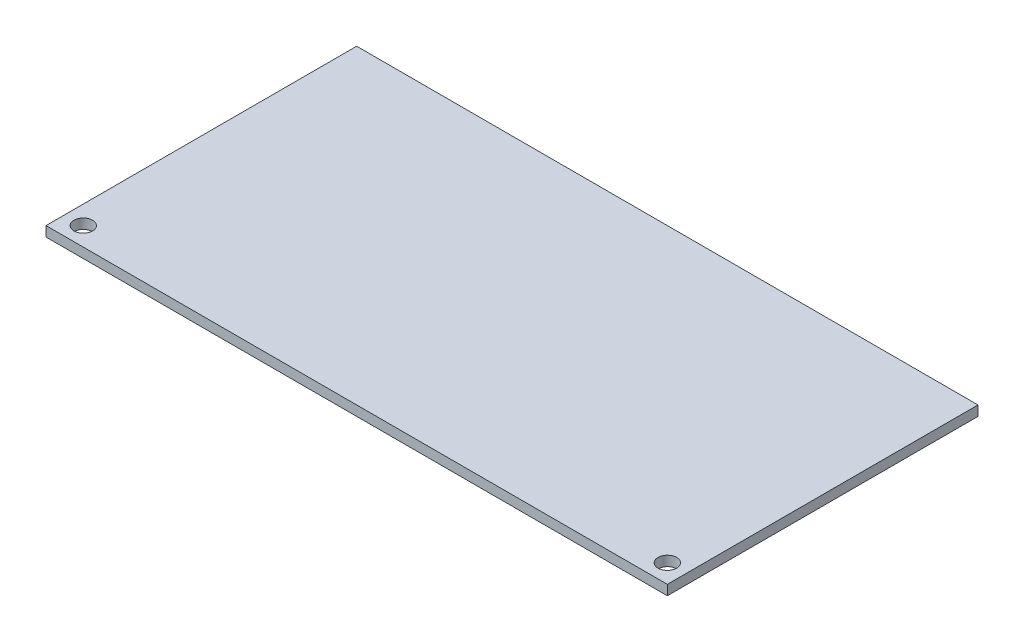
from build123d import *

# Parameters (mm, degrees)
SKETCH1_W           = 100
SKETCH1_H           = 50
BOSS_EXTRUDE1_DEPTH = 1.6
CUT_EXTRUDE1_REACH  = 113.815
SKETCH2_R           = 1.5


with BuildPart() as part:
    # Sketch1 → Boss-Extrude1 (new body)
    with BuildSketch(Plane(origin=(0, 0, 0), x_dir=(1, 0, 0), z_dir=(0, 1, 0))):
        with Locations((50, 25)):
            Rectangle(SKETCH1_W, SKETCH1_H)
    extrude(amount=BOSS_EXTRUDE1_DEPTH)

    # Sketch2 → Cut-Extrude1 (cut, up to next)
    with BuildSketch(Plane(origin=(0, 1.6, 0), x_dir=(1, 0, 0), z_dir=(0, 1, 0)), mode=Mode.PRIVATE) as cut_extrude1_sk1:
        with Locations((3, 3)):
            Circle(SKETCH2_R)
    cut_extrude1_tool1 = extrude(cut_extrude1_sk1.sketch, amount=-CUT_EXTRUDE1_REACH, mode=Mode.PRIVATE) & part.part
    # Sketch2 → Cut-Extrude1 (cut, up to next)
    with BuildSketch(Plane(origin=(0, 1.6, 0), x_dir=(1, 0, 0), z_dir=(0, 1, 0)), mode=Mode.PRIVATE) as cut_extrude1_sk2:
        with Locations((97, 3)):
            Circle(SKETCH2_R)
    cut_extrude1_tool2 = extrude(cut_extrude1_sk2.sketch, amount=-CUT_EXTRUDE1_REACH, mode=Mode.PRIVATE) & part.part
    add(cut_extrude1_tool1.solids().sort_by_distance((3, 1.6, -3))[0], mode=Mode.SUBTRACT)
    add(cut_extrude1_tool2.solids().sort_by_distance((97, 1.6, -3))[0], mode=Mode.SUBTRACT)


solid = part.part
